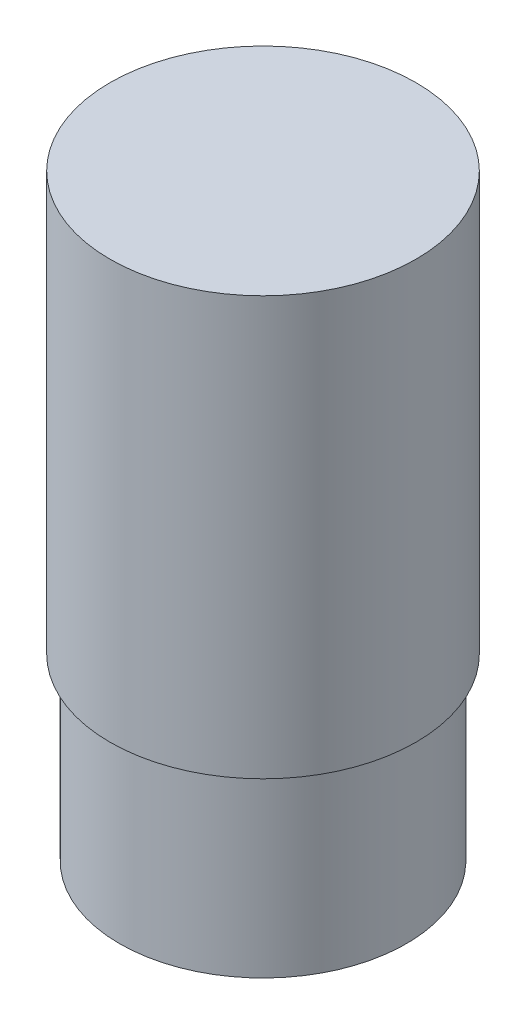
from build123d import *

# Parameters (mm, degrees)
SKETCH1_R           = 4.064
BOSS_EXTRUDE1_DEPTH = 15.875
SKETCH2_R           = 4.064
SKETCH2_R_2         = 3.81
CUT_EXTRUDE1_DEPTH  = 4.7625


with BuildPart() as part:
    # Sketch1 → Boss-Extrude1 (new body)
    with BuildSketch(Plane(origin=(0, 0, 0), x_dir=(1, 0, 0), z_dir=(0, 1, 0))):
        Circle(SKETCH1_R)
    extrude(amount=BOSS_EXTRUDE1_DEPTH)

    # Sketch2 → Cut-Extrude1 (cut)
    with BuildSketch(Plane.XZ):
        Circle(SKETCH2_R)
        Circle(SKETCH2_R_2, mode=Mode.SUBTRACT)
    extrude(amount=-CUT_EXTRUDE1_DEPTH, mode=Mode.SUBTRACT)


solid = part.part
